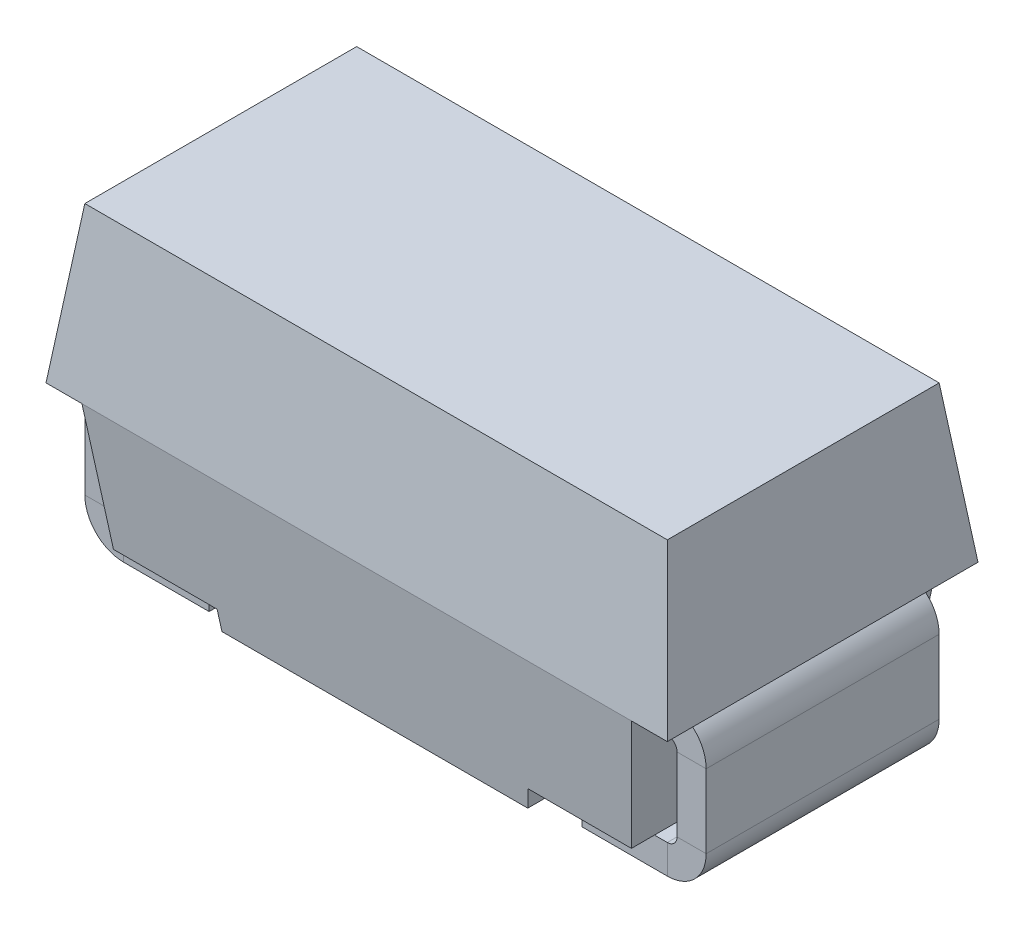
from build123d import *

# Parameters (mm, degrees)
ESQUISSE1_W                    = 3.2
ESQUISSE1_H                    = 1.6
BOSS_EXTRU_1_DEPTH             = 0.8
BOSS_EXTRU_1_TAPER             = 7.125016349
ESQUISSE3_W                    = 2.83
ESQUISSE3_H                    = 1.6
BOSS_EXTRU_2_DEPTH             = 0.65
BOSS_EXTRU_2_TAPER             = 7.125016349
T_LE_DE_BASE_PLI_E1_DEPTH      = 0.6
T_LE_DE_BASE_PLI_E1_DEPTH_BACK = 0.6
ESQUISSE11_W                   = 1.6
ESQUISSE11_H                   = 1.4375
BOSS_EXTRU_3_DEPTH             = 0.1
BOSS_EXTRU_3_TAPER             = 7.125016349


# Sheet-metal steps are written as plain solids
with BuildPart() as part:
    # Esquisse1 → Boss.-Extru.1 (new body)
    with BuildSketch(Plane(origin=(0, 0, 0), x_dir=(1, 0, 0), z_dir=(0, 1, 0))):
        Rectangle(ESQUISSE1_W, ESQUISSE1_H)
    extrude(amount=BOSS_EXTRU_1_DEPTH, taper=BOSS_EXTRU_1_TAPER)

    # Esquisse3 → Boss.-Extru.2 (add)
    with BuildSketch(Plane.XZ):
        Rectangle(ESQUISSE3_W, ESQUISSE3_H)
    extrude(amount=BOSS_EXTRU_2_DEPTH, taper=BOSS_EXTRU_2_TAPER)

    # Esquisse11 → Boss.-Extru.3 (add)
    with BuildSketch(Plane.XZ.offset(0.65)):
        Rectangle(ESQUISSE11_W, ESQUISSE11_H)
    extrude(amount=BOSS_EXTRU_3_DEPTH, taper=BOSS_EXTRU_3_TAPER)


with BuildPart() as body_2:
    # Esquisse4 → Tôle de base pliée1 (new, two sides: drawn at the far end of the back side and taken through both)
    with BuildSketch(Plane.XY.offset(-T_LE_DE_BASE_PLI_E1_DEPTH_BACK)):
        with BuildLine():
            Line((-1.39375, -0.17), (-1.406201737, -0.171556467))
            ThreePointArc((-1.406201737, -0.171556467), (-1.437483909, -0.188080233), (-1.45, -0.221170361))
            Line((-1.45, -0.221170361), (-1.45, -0.6))
            ThreePointArc((-1.45, -0.6), (-1.435355339, -0.635355339), (-1.4, -0.65))
            Line((-1.4, -0.65), (-0.96, -0.65))
            Line((-0.96, -0.65), (-0.96, -0.8))
            Line((-0.96, -0.8), (-1.4, -0.8))
            ThreePointArc((-1.4, -0.8), (-1.541421356, -0.741421356), (-1.6, -0.6))
            Line((-1.6, -0.6), (-1.6, -0.221170361))
            ThreePointArc((-1.6, -0.221170361), (-1.549935635, -0.088809848), (-1.424806947, -0.022714786))
            Line((-1.424806947, -0.022714786), (-1.41235521, -0.021158318))
            Line((-1.41235521, -0.021158318), (-1.39375, -0.17))
        make_face()
    extrude(amount=T_LE_DE_BASE_PLI_E1_DEPTH + T_LE_DE_BASE_PLI_E1_DEPTH_BACK)


with BuildPart() as body_3:
    # Symétrie1: mirrored copy
    add(body_2.part.mirror(Plane(origin=(0, 0, 0), x_dir=(0, 0, 1), z_dir=(1, 0, 0))))


solid = Compound([part.part, body_2.part, body_3.part])
